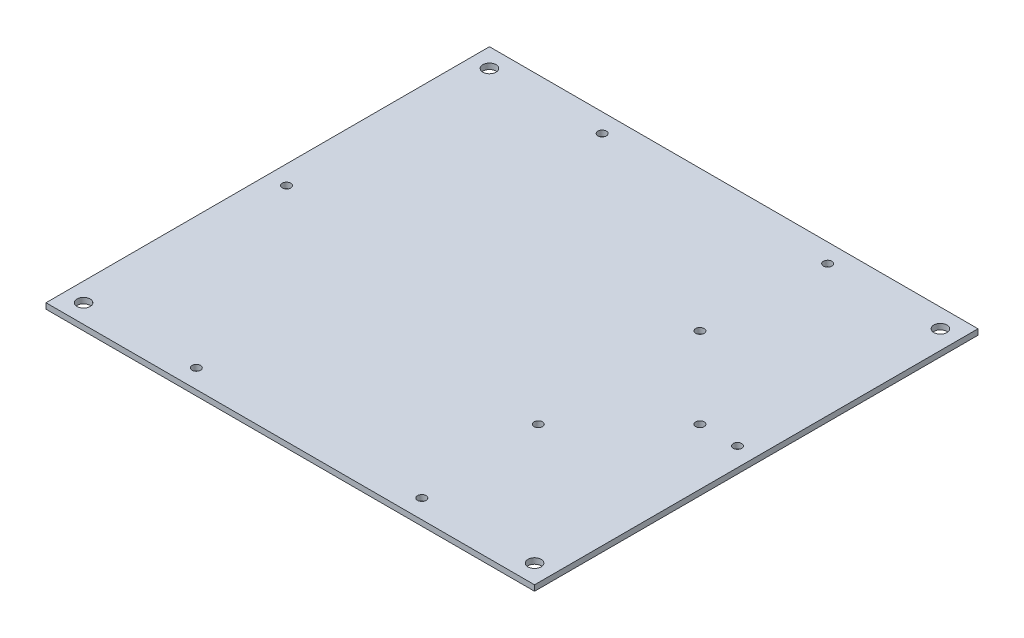
from build123d import *

# Parameters (mm, degrees)
SKETCH_1_W          = 260
SKETCH_1_H          = 236
EXTRUDE_1_DEPTH     = 3
SKETCH_2_R          = 2.25
SKETCH_2_R_2        = 3.5
CUT_EXTRUDE_1_DEPTH = 308.649337391
SKETCH1_R           = 2.25
CUT_EXTRUDE1_DEPTH  = 308.649337391


with BuildPart() as part:
    # Эскиз1 → Бобышка-Вытянуть1 (new body)
    with BuildSketch(Plane.XZ):
        with Locations((-88.97919902, 98.072268451)):
            Rectangle(SKETCH_1_W, SKETCH_1_H)
    extrude(amount=EXTRUDE_1_DEPTH)

    # Эскиз2 → Вырез-Вытянуть1 (cut, through all)
    with BuildSketch(Plane.XZ.offset(3)):
        with Locations((-208.97919902, 98.072268451)):
            Circle(SKETCH_2_R)
        with Locations((-148.97919902, -9.927731549)):
            Circle(SKETCH_2_R)
        with Locations((-28.97919902, -9.927731549)):
            Circle(SKETCH_2_R)
        with Locations((31.02080098, 98.072268451)):
            Circle(SKETCH_2_R)
        with Locations((-28.97919902, 206.072268451)):
            Circle(SKETCH_2_R)
        with Locations((-148.97919902, 206.072268451)):
            Circle(SKETCH_2_R)
        with Locations((-208.97919902, -9.927731549)):
            Circle(SKETCH_2_R_2)
        with Locations((-208.97919902, 206.072268451)):
            Circle(SKETCH_2_R_2)
        with Locations((31.02080098, -9.927731549)):
            Circle(SKETCH_2_R_2)
        with Locations((31.02080098, 206.072268451)):
            Circle(SKETCH_2_R_2)
    extrude(amount=-CUT_EXTRUDE_1_DEPTH, mode=Mode.SUBTRACT)

    # Sketch1 → Cut-Extrude1 (cut, through all)
    with BuildSketch(Plane(origin=(0, 0, 0), x_dir=(1, 0, 0), z_dir=(0, 1, 0))):
        with Locations((-31.97919902, -141.072268451)):
            Circle(SKETCH1_R)
        with Locations((11.02080098, -98.072268451)):
            Circle(SKETCH1_R)
        with Locations((-31.97919902, -55.072268451)):
            Circle(SKETCH1_R)
    extrude(amount=-CUT_EXTRUDE1_DEPTH, mode=Mode.SUBTRACT)


solid = part.part
